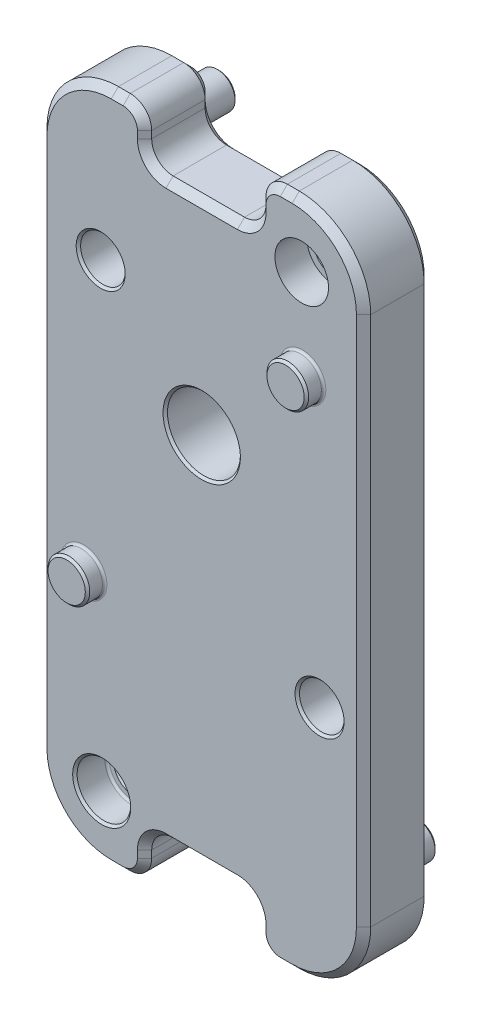
from build123d import *

# Parameters (mm, degrees)
SKETCH2_W                            = 28.7782
SKETCH2_H                            = 59.832519375
SKETCH2_R                            = 3.2385
SKETCH2_R_2                          = 1.5875
BOSS_EXTRUDE1_DEPTH                  = 6.0198
SKETCH3_R                            = 2.38125
CUT_EXTRUDE1_COUNTER_SINK_DEPTH      = 2.8448
SKETCH4_R                            = 1.5875
BOSS_EXTRUDE2_BACKPEGS_DEPTH         = 4.445
SKETCH5_R                            = 1.9812
CUT_EXTRUDE2_ENCODERSCREWHOLES_DEPTH = 42.371886932
SKETCH6_R                            = 1.8542
BOSS_EXTRUDE3_ENCODERPEGS_DEPTH      = 1.524
SKETCH7_R                            = 3.96875
BOSS_EXTRUDE4_DEPTH                  = 3.175
SKETCH10_W                           = 10.16
SKETCH10_H                           = 4.445
CUT_EXTRUDE3_DEPTH                   = 41.731190846
FILLET1_0_25_R                       = 6.35
FILLET5_R                            = 1.905
FILLET4_0_075_R                      = 1.905
FILLET3_1_128_R                      = 0.1984375
CHAMFER1_0_25_SIZE                   = 0.635
CHAMFER2_1_128_SIZE                  = 0.1984375
CHAMFER3_1_64_SIZE                   = 0.396875


with BuildPart() as part:
    # Sketch2 → Boss-Extrude1 (new body)
    with BuildSketch(Plane.XY):
        with Locations((0, -7.434440313)):
            Rectangle(SKETCH2_W, SKETCH2_H)
        Circle(SKETCH2_R, mode=Mode.SUBTRACT)
        with Locations((8.89, 16.982719375)):
            Circle(SKETCH2_R_2, mode=Mode.SUBTRACT)
        with Locations((-8.89, -31.8516)):
            Circle(SKETCH2_R_2, mode=Mode.SUBTRACT)
    extrude(amount=BOSS_EXTRUDE1_DEPTH)

    # Sketch3 → Cut-Extrude1_Counter-sink (cut)
    with BuildSketch(Plane.XY.offset(6.0198)):
        with Locations((-8.89, -31.8516)):
            Circle(SKETCH3_R)
        with Locations((8.89, 16.982719375)):
            Circle(SKETCH3_R)
    extrude(amount=-CUT_EXTRUDE1_COUNTER_SINK_DEPTH, mode=Mode.SUBTRACT)

    # Sketch4 → Boss-Extrude2_BackPegs (add)
    with BuildSketch(Plane(origin=(0, 0, 0), x_dir=(-1, 0, 0), z_dir=(0, 0, -1))):
        with Locations((-8.89, -31.8516)):
            Circle(SKETCH4_R)
        with Locations((8.89, 16.982719375)):
            Circle(SKETCH4_R)
    extrude(amount=BOSS_EXTRUDE2_BACKPEGS_DEPTH)

    # Sketch5 → Cut-Extrude2_EncoderScrewHoles (cut, through all)
    with BuildSketch(Plane.XY.offset(6.0198)):
        with Locations((10.4775, -15.748)):
            Circle(SKETCH5_R)
        with Locations((-8.9789, 8.981612037)):
            Circle(SKETCH5_R)
    extrude(amount=-CUT_EXTRUDE2_ENCODERSCREWHOLES_DEPTH, mode=Mode.SUBTRACT)

    # Sketch6 → Boss-Extrude3_EncoderPegs (add)
    with BuildSketch(Plane.XY.offset(6.0198)):
        with Locations((-10.4775, -15.748)):
            Circle(SKETCH6_R)
        with Locations((8.9789, 8.981612037)):
            Circle(SKETCH6_R)
    extrude(amount=BOSS_EXTRUDE3_ENCODERPEGS_DEPTH)

    # Sketch7 → Boss-Extrude4 (add)
    with BuildSketch(Plane(origin=(0, 0, 0), x_dir=(-1, 0, 0), z_dir=(0, 0, -1))):
        with Locations((0, -11.9507)):
            Circle(SKETCH7_R)
    extrude(amount=BOSS_EXTRUDE4_DEPTH)

    # Sketch10 → Cut-Extrude3 (cut, through all)
    with BuildSketch(Plane(origin=(0, 0, 0), x_dir=(-1, 0, 0), z_dir=(0, 0, -1))):
        with Locations((0, 20.259319375)):
            Rectangle(SKETCH10_W, SKETCH10_H)
    cut_extrude3 = extrude(amount=-CUT_EXTRUDE3_DEPTH, mode=Mode.SUBTRACT)

    # Mirror1: Cut-Extrude3 across plane
    add(cut_extrude3.mirror(Plane(origin=(0, -7.434440312, 0), x_dir=(0, 0, 1), z_dir=(0, -1, 0))), mode=Mode.SUBTRACT)

    # Fillet1_0.25
    fillet1_0_25_edges = [part.edges().sort_by_distance(p)[0] for p in [
        (-14.3891, -37.3507, 3.0099),
        (14.3891, -37.3507, 3.0099),
        (14.3891, 22.481819375, 3.0099),
        (-14.3891, 22.481819375, 3.0099),
    ]]
    fillet(fillet1_0_25_edges, radius=FILLET1_0_25_R)

    # Fillet5
    fillet5_edges = [part.edges().sort_by_distance(p)[0] for p in [
        (-5.08, 22.481819375, 3.0099),
        (5.08, 22.481819375, 3.0099),
        (5.08, -37.3507, 3.0099),
        (-5.08, -37.3507, 3.0099),
    ]]
    fillet(fillet5_edges, radius=FILLET5_R)

    # Fillet4_0.075
    fillet4_0_075_edges = [part.edges().sort_by_distance(p)[0] for p in [
        (-5.08, 18.036819375, 3.0099),
        (5.08, 18.036819375, 3.0099),
        (-5.08, -32.9057, 3.0099),
        (5.08, -32.9057, 3.0099),
    ]]
    fillet(fillet4_0_075_edges, radius=FILLET4_0_075_R)

    # Fillet3_1/128
    fillet3_1_128_edges = [part.edges().sort_by_distance(p)[0] for p in [
        (-11.27125, -31.8516, 3.175),
        (10.4775, -31.8516, 0),
        (-7.3025, 16.982719375, 0),
        (7.1247, 8.981612037, 6.0198),
        (-12.3317, -15.748, 6.0198),
        (3.96875, -11.9507, 0),
    ]]
    fillet(fillet3_1_128_edges, radius=FILLET3_1_128_R)

    # Chamfer1_0.25
    chamfer1_0_25_edges = [part.edges().sort_by_distance(p)[0] for p in [
        (-12.529228061, -35.490828061, 6.0198),
        (-14.3891, -7.434440312, 6.0198),
        (-12.529228061, 20.621947436, 6.0198),
        (-12.529228061, -35.490828061, 0),
        (-14.3891, -7.434440312, 0),
        (-12.529228061, 20.621947436, 0),
        (-7.51205, 22.481819375, 0),
        (-7.51205, 22.481819375, 6.0198),
        (5.08, 20.259319375, 0),
        (4.522038418, 18.594780957, 0),
        (0, 18.036819375, 0),
        (-4.522038418, 18.594780957, 0),
        (-5.08, 20.259319375, 0),
        (5.08, 20.259319375, 6.0198),
        (4.522038418, 18.594780957, 6.0198),
        (0, 18.036819375, 6.0198),
        (-4.522038418, 18.594780957, 6.0198),
        (-5.08, 20.259319375, 6.0198),
        (5.637961582, 21.923857793, 0),
        (-5.637961582, 21.923857793, 0),
        (5.637961582, 21.923857793, 6.0198),
        (-5.637961582, 21.923857793, 6.0198),
    ]]
    chamfer(chamfer1_0_25_edges, length=CHAMFER1_0_25_SIZE)

    # Chamfer2_1/128
    chamfer2_1_128_edges = [part.edges().sort_by_distance(p)[0] for p in [
        (-10.4775, -31.8516, 3.175),
        (-3.2385, 0, 6.0198),
        (7.3025, 16.982719375, 0),
        (-10.9601, 8.981612037, 6.0198),
        (-10.9601, 8.981612037, 0),
        (8.4963, -15.748, 6.0198),
        (8.4963, -15.748, 0),
        (10.4775, -31.8516, -4.445),
        (-7.3025, 16.982719375, -4.445),
        (-12.3317, -15.748, 7.5438),
        (7.1247, 8.981612037, 7.5438),
        (-10.4775, -31.8516, 0),
        (-11.27125, -31.8516, 6.0198),
        (7.3025, 16.982719375, 3.175),
    ]]
    chamfer(chamfer2_1_128_edges, length=CHAMFER2_1_128_SIZE)

    # Chamfer3_1/64
    chamfer3_1_64_edges = [part.edges().sort_by_distance(p)[0] for p in [
        (3.96875, -11.9507, -3.175),
    ]]
    chamfer(chamfer3_1_64_edges, length=CHAMFER3_1_64_SIZE)


solid = part.part
